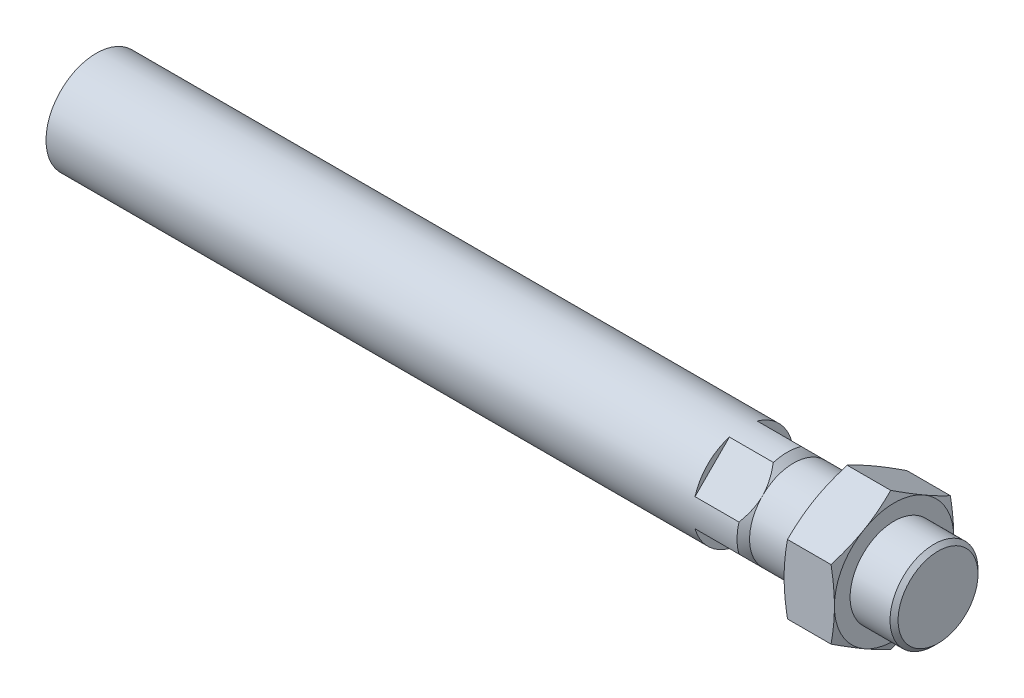
from build123d import *

# Parameters (mm, degrees)
EXTRUDE_START       = -7
EXTRUDE_1_DEPTH     = 8
EXTRUDE_START_2     = 7
SKETCH_3_R          = 7
EXTRUDE_2_DEPTH     = 23
SKETCH_4_R          = 8
EXTRUDE_3_DEPTH     = 111
CHAMFER_1_SIZE      = 1
CHAMFER_2_SIZE      = 0.64
CUT_EXTRUDE_START   = -23
SKETCH_6_OUTSIDE_W  = 48.422
SKETCH_6_OUTSIDE_H  = 51.362
CUT_EXTRUDE_2_DEPTH = 8


with BuildPart() as part:
    # 草图2 → 凸台-拉伸1 (new body)
    with BuildSketch(Plane(origin=(0, 0, 0), x_dir=(0, 0, -1), z_dir=(1, 0, 0)).offset(EXTRUDE_START)):
        Polygon((0, 10.969655115), (-9.5, 5.484827557), (-9.5, -5.484827557), (0, -10.969655115), (9.5, -5.484827557), (9.5, 5.484827557), align=None)
    extrude(amount=-EXTRUDE_1_DEPTH)

    # 草图3 → 凸台-拉伸2 (add)
    with BuildSketch(Plane(origin=(-7, 0, 0), x_dir=(0, 0, -1), z_dir=(1, 0, 0)).offset(EXTRUDE_START_2)):
        Circle(SKETCH_3_R)
    extrude(amount=-EXTRUDE_2_DEPTH)

    # 草图4 → 凸台-拉伸3 (add)
    with BuildSketch(Plane.ZY.offset(23)):
        Circle(SKETCH_4_R)
    extrude(amount=EXTRUDE_3_DEPTH)

    # 倒角1
    chamfer_1_edges = [part.edges().sort_by_distance(p)[0] for p in [
        (-23, 0, -8),
    ]]
    chamfer(chamfer_1_edges, length=CHAMFER_1_SIZE - 0.0001)  # a hair under: the kernel refuses the full size

    # 倒角2
    chamfer_2_edges = [part.edges().sort_by_distance(p)[0] for p in [
        (0, 0, 7),
    ]]
    chamfer(chamfer_2_edges, length=CHAMFER_2_SIZE)

    # 草图5 → 切除-旋转1 (revolve, cut)
    with BuildSketch(Plane(origin=(0, 0, 0), x_dir=(1, 0, 0), z_dir=(0, 1, 0)), mode=Mode.PRIVATE) as cut_revolve_1_sk:
        Polygon((-7, 9.5), (-7, 30.489909678), (-15, 30.489909678), (-15, 9.5), (-11, 20.489909678), align=None)
    revolve(cut_revolve_1_sk.sketch.rotate(Axis((0, 0, 0), (-1, 0, 0)), 180), axis=Axis((0, 0, 0), (-1, 0, 0)), mode=Mode.SUBTRACT)

    # 草图6 outside → 切除-拉伸2 (cut)
    with BuildSketch(Plane(origin=(0, 0, 0), x_dir=(0, 0, -1), z_dir=(1, 0, 0)).offset(CUT_EXTRUDE_START)):
        Rectangle(SKETCH_6_OUTSIDE_W, SKETCH_6_OUTSIDE_H)
        Polygon((0, 9.899494937), (-9.899494937, 0), (0, -9.899494937), (9.899494937, 0), align=None, mode=Mode.SUBTRACT)
    extrude(amount=-CUT_EXTRUDE_2_DEPTH, mode=Mode.SUBTRACT)


solid = part.part
